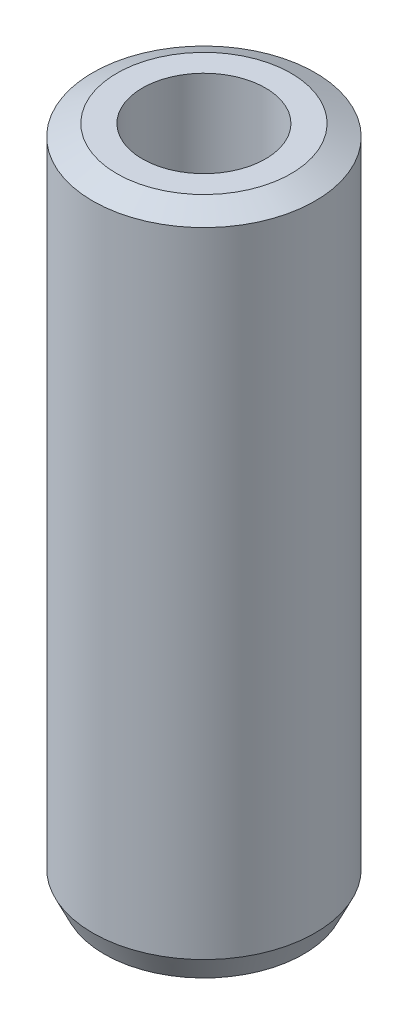
from build123d import *
from OCP.BRepFilletAPI import BRepFilletAPI_MakeChamfer

# Parameters (mm, degrees)
SKETCH1_R           = 50
BOSS_EXTRUDE1_DEPTH = 301.030965563
SKETCH2_R           = 27.667980363
CUT_EXTRUDE1_DEPTH  = 310.224258795
CHAMFER1_SIZE       = 5.198990415
CHAMFER1_SIZE2      = 10.846233063


with BuildPart() as part:
    # Sketch1 → Boss-Extrude1 (new body)
    with BuildSketch(Plane(origin=(0, 0, 0), x_dir=(1, 0, 0), z_dir=(0, 1, 0))):
        Circle(SKETCH1_R)
    extrude(amount=BOSS_EXTRUDE1_DEPTH)

    # Sketch2 → Cut-Extrude1 (cut, through all)
    with BuildSketch(Plane(origin=(0, 0, 0), x_dir=(1, 0, 0), z_dir=(0, 1, 0))):
        Circle(SKETCH2_R)
    extrude(amount=CUT_EXTRUDE1_DEPTH, mode=Mode.SUBTRACT)

    # Chamfer1: one chamfer whose edges measure the first distance from different faces: ONE call of the kernel's chamfer builder (chamfer() names one face for all edges)
    chamfer1_edges_1 = [part.edges().sort_by_distance(p)[0] for p in [
        (-50, 301.030965563, 0),
    ]]
    chamfer1_side_1 = [part.faces().sort_by_distance(p)[0] for p in [
        (-50, 150.515482781, 0),
    ]]
    chamfer1_edges_2 = [part.edges().sort_by_distance(p)[0] for p in [
        (-50, 0, 0),
    ]]
    chamfer1_side_2 = [part.faces().sort_by_distance(p)[0] for p in [
        (-48.585786438, 0, 0),
    ]]
    chamfer1 = BRepFilletAPI_MakeChamfer(part.part.solid().wrapped)
    for e in chamfer1_edges_1:
        chamfer1.Add(CHAMFER1_SIZE, CHAMFER1_SIZE2, e.wrapped, chamfer1_side_1[0].wrapped)  # the first distance lies on this face
    for e in chamfer1_edges_2:
        chamfer1.Add(CHAMFER1_SIZE, CHAMFER1_SIZE2, e.wrapped, chamfer1_side_2[0].wrapped)  # the first distance lies on this face
    add(Compound.cast(chamfer1.Shape()), mode=Mode.REPLACE)


solid = part.part
